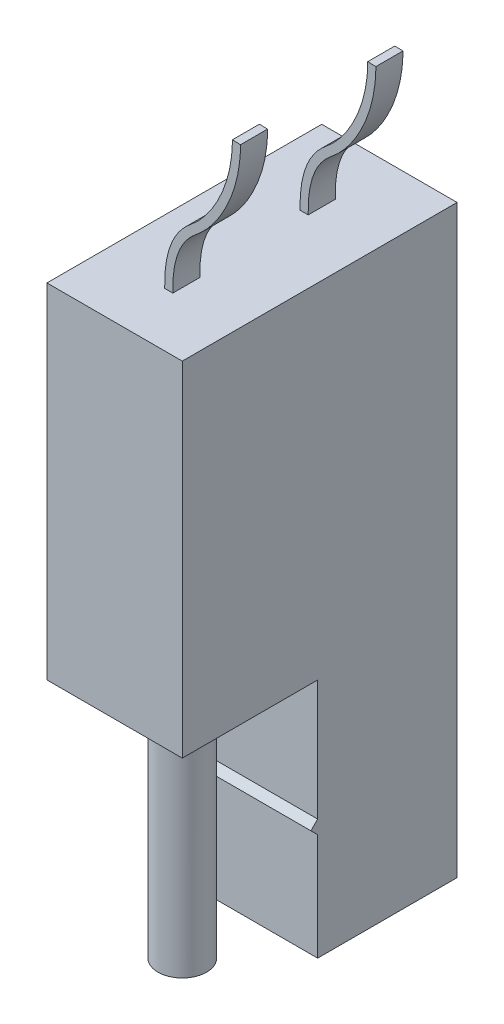
from build123d import *

# Parameters (mm, degrees)
SKETCH1_W           = 1
SKETCH1_H           = 4.32
BOSS_EXTRUDE1_DEPTH = 2.03
SKETCH2_W           = 1
SKETCH2_H           = 1.78
CUT_EXTRUDE1_DEPTH  = 1
SKETCH3_R           = 0.179640036
SKETCH3_R_2         = 0.141754664
BOSS_EXTRUDE2_DEPTH = 1.78
SKETCH3_3_R         = 0.19
CUT_EXTRUDE2_DEPTH  = 4.28975683
SKETCH7_W           = 0.06
SKETCH7_H           = 0.2
MIRROR1_START       = 0.43
MIRROR1_DEPTH       = 0.2
BOSS_EXTRUDE3_DEPTH = 1


with BuildPart() as part:
    # Sketch1 → Boss-Extrude1 (new body)
    with BuildSketch(Plane.XY):
        Rectangle(SKETCH1_W, SKETCH1_H)
    extrude(amount=BOSS_EXTRUDE1_DEPTH)

    # Sketch2 → Cut-Extrude1 (cut)
    with BuildSketch(Plane.XY.offset(2.03)):
        with Locations((0, -1.27)):
            Rectangle(SKETCH2_W, SKETCH2_H)
    extrude(amount=-CUT_EXTRUDE1_DEPTH, mode=Mode.SUBTRACT)

    # Sketch3 → Boss-Extrude2 (add)
    with BuildSketch(Plane.XZ.offset(0.38)):
        with Locations(Location((0, 1.53, 0), (0, 0, 90))):
            Circle(SKETCH3_R)
        with Locations(Location((0, 1.53, 0), (0, 0, 270))):
            Circle(SKETCH3_R_2, mode=Mode.SUBTRACT)
    extrude(amount=BOSS_EXTRUDE2_DEPTH)

    # Sketch3<3> → Cut-Extrude2 (cut, through all)
    with BuildSketch(Plane.XZ.offset(0.38)):
        with Locations(Location((0, 0.53, 0), (0, 0, 270))):
            Circle(SKETCH3_3_R)
    extrude(amount=CUT_EXTRUDE2_DEPTH, mode=Mode.SUBTRACT)

    # Sweep2: sweep along a path in Sketch6
    with BuildLine() as sweep2_path:  # in the path sketch's own coordinates; laid on its plane below (add() does not lay a ready-made edge on the line's plane)
        add(Edge.make_bspline(
            [(0, 2.16), (0.006618512, 2.413579092), (-0.099153844, 2.580707218), (-0.318669183, 2.747242888), (-0.5, 3.04153675), (-0.5, 3.36)],
            knots=[0, 0, 0, 0, 0.33988837, 0.43988837, 1, 1, 1, 1], degree=3))
    # Sketch7 → Sweep2 (sweep)
    with BuildSketch(Plane(origin=(0, 2.16, 0), x_dir=(1, 0, 0), z_dir=(0, 1, 0))):
        with Locations((0, -1.53)):
            Rectangle(SKETCH7_W, SKETCH7_H)
    sweep(path=Plane(origin=(0, 0, 1.53), x_dir=(-1, 0, 0), z_dir=(0, 0, -1)) * sweep2_path.line)

    # Mirror1: read off the stored shape, not the designer's step
    # Mirror1 outline → Mirror1 (add)
    with BuildSketch(Plane.XY.offset(MIRROR1_START)):
        with BuildLine():
            Line((-0.03, 2.16), (0.03, 2.16))
            add(Edge.make_bspline(
                [(0.03, 2.16), (0.026689237, 2.283494275), (0.044838373, 2.374836995), (0.09950353, 2.512679036), (0.135974255, 2.559401221), (0.192448919, 2.613751579), (0.214161718, 2.63024792), (0.305479678, 2.713719563), (0.377816112, 2.80815353), (0.490125853, 3.048840143), (0.529863619, 3.195099656), (0.529989787, 3.359217255)],
                knots=[0, 0, 0, 0, 0.169944185, 0.169944185, 0.33988837, 0.33988837, 0.43988837, 0.43988837, 0.719944185, 0.719944185, 1, 1, 1, 1], degree=3))
            Line((0.529989787, 3.359217255), (0.470010213, 3.360782745))
            add(Edge.make_bspline(
                [(-0.03, 2.16), (-0.033307725, 2.290084846), (-0.013902459, 2.390098952), (0.047964171, 2.544727536), (0.090471438, 2.599118005), (0.15508015, 2.660870348), (0.177270449, 2.677680388), (0.259162827, 2.752955531), (0.327574678, 2.841864618), (0.432943498, 3.068609235), (0.470136161, 3.2064371), (0.470010213, 3.360782745)],
                knots=[0, 0, 0, 0, 0.169944185, 0.169944185, 0.33988837, 0.33988837, 0.43988837, 0.43988837, 0.719944185, 0.719944185, 1, 1, 1, 1], degree=3))
        make_face()
    extrude(amount=MIRROR1_DEPTH)

    # Sketch8 → Boss-Extrude3 (add)
    with BuildSketch(Plane(origin=(0.5, 0, 0), x_dir=(0, 0, -1), z_dir=(1, 0, 0))):
        Polygon((-1.03, -1.27), (-1.08, -1.32), (-1.03, -1.37), align=None)
    extrude(amount=-BOSS_EXTRUDE3_DEPTH)


solid = part.part
